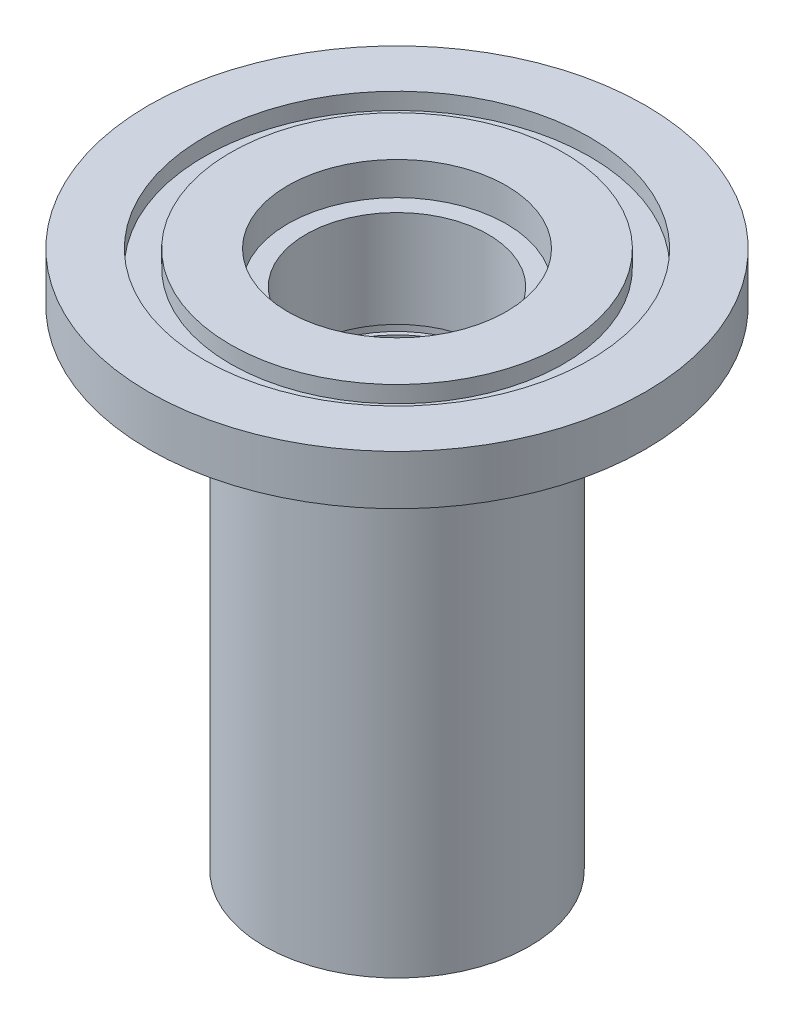
from build123d import *


with BuildPart() as part:
    # Sketch1 → Revolve1 (revolve)
    with BuildSketch(Plane.XY):
        Polygon((30, 0), (23.293592912, 0), (23.293592912, -2.015700421), (20.108151749, -2.015700421), (20.108151749, 0), (13.2, 0), (13.2, -4), (11, -4), (11, -15.7), (11.5, -15.7), (11.5, -16.8), (11, -16.8), (11, -31.2), (11.5, -31.2), (11.5, -32.3), (11, -32.3), (11, -65), (16, -65), (16, -6), (30, -6), align=None)
    revolve(axis=Axis((0, 0, 0), (0, -1, 0)))


solid = part.part
